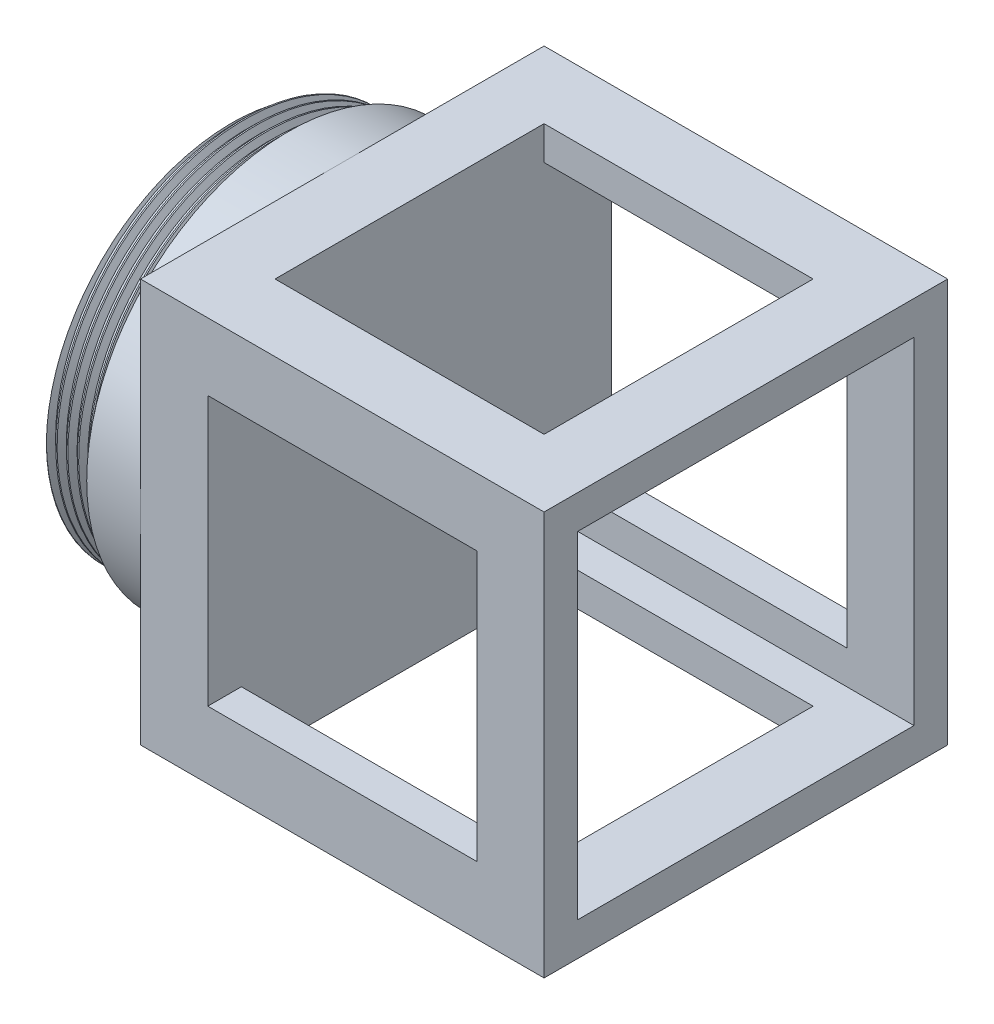
from build123d import *

# Parameters (mm, degrees)
SKETCH1_W           = 75
SKETCH1_H           = 75
SKETCH1_W_2         = 50
SKETCH1_H_2         = 50
BOSS_EXTRUDE1_DEPTH = 37.5
CUT_EXTRUDE1_REACH  = 93.856
SKETCH2_W           = 50
SKETCH2_H           = 50
CUT_EXTRUDE2_REACH  = 93.856
SKETCH3_W           = 62.5
SKETCH3_H           = 62.5
SKETCH4_R           = 37.5
BOSS_EXTRUDE2_DEPTH = 10
SKETCH5_R           = 35
SKETCH5_R_2         = 32.5
BOSS_EXTRUDE3_DEPTH = 10
THREAD4_PITCH       = 2


with BuildPart() as part:
    # Sketch1 → Boss-Extrude1 (new, symmetric)
    with BuildSketch(Plane.XY):
        Rectangle(SKETCH1_W, SKETCH1_H)
        Rectangle(SKETCH1_W_2, SKETCH1_H_2, mode=Mode.SUBTRACT)
    extrude(amount=BOSS_EXTRUDE1_DEPTH, both=True)

    # Cut-Extrude1: up to this face of the body (flat: up to its plane)
    cut_extrude1_end = Plane(part.part.faces().sort_by_distance((0, -37.5, 0))[0])
    # Sketch2 → Cut-Extrude1 (cut, up to the picked face)
    with BuildSketch(Plane(origin=(0, 37.5, 0), x_dir=(1, 0, 0), z_dir=(0, 1, 0)), mode=Mode.PRIVATE) as cut_extrude1_sk1:
        Rectangle(SKETCH2_W, SKETCH2_H)
    cut_extrude1_tool1 = split(extrude(cut_extrude1_sk1.sketch, amount=-CUT_EXTRUDE1_REACH, mode=Mode.PRIVATE), bisect_by=cut_extrude1_end, keep=Keep.BOTH, mode=Mode.PRIVATE)
    add(cut_extrude1_tool1.solids().sort_by(Axis((0, 37.5, 0), (0, -1, 0)))[0], mode=Mode.SUBTRACT)

    # Cut-Extrude2: up to this face of the body (flat: up to its plane)
    cut_extrude2_end = Plane(part.part.faces().sort_by_distance((-25, 0, 0))[0])
    # Sketch3 → Cut-Extrude2 (cut, up to the picked face)
    with BuildSketch(Plane(origin=(37.5, 0, 0), x_dir=(0, 0, -1), z_dir=(1, 0, 0)), mode=Mode.PRIVATE) as cut_extrude2_sk1:
        Rectangle(SKETCH3_W, SKETCH3_H)
    cut_extrude2_tool1 = split(extrude(cut_extrude2_sk1.sketch, amount=-CUT_EXTRUDE2_REACH, mode=Mode.PRIVATE), bisect_by=cut_extrude2_end, keep=Keep.BOTH, mode=Mode.PRIVATE)
    add(cut_extrude2_tool1.solids().sort_by(Axis((37.5, 0, 0), (-1, 0, 0)))[0], mode=Mode.SUBTRACT)

    # Sketch4 → Boss-Extrude2 (add)
    with BuildSketch(Plane.ZY.offset(37.5)):
        Circle(SKETCH4_R)
    extrude(amount=BOSS_EXTRUDE2_DEPTH)

    # Sketch5 → Boss-Extrude3 (add)
    with BuildSketch(Plane.ZY.offset(47.5)):
        Circle(SKETCH5_R)
        Circle(SKETCH5_R_2, mode=Mode.SUBTRACT)
    extrude(amount=BOSS_EXTRUDE3_DEPTH)

    # Thread4: the profile of Thread Profile2 profile screwed along a right-hand helix of 5.5 turns, 10 arcs to a turn; built about Z, then put on its axis
    thread4_z = Axis((0, 0, 0), (0, 0, 1))
    thread4_corners = [(35.0003, 0, -0.000173205), (35.0003, 0, 1.7501732), (33.91746825, 0, 1.124999997), (33.91746825, 0, 0.624999997)]
    with BuildLine(mode=Mode.PRIVATE) as thread4_profile:
        Line(thread4_corners[0], thread4_corners[1])
        Line(thread4_corners[1], thread4_corners[2])
        Line(thread4_corners[2], thread4_corners[3])
        Line(thread4_corners[3], thread4_corners[0])
    thread4_cap = Face(thread4_profile.wire())
    thread4_turn_angles = [0, 18, 36, 54, 72, 90, 108, 126, 144, 162, 180, 198, 216, 234, 252, 270, 288, 306, 324, 342, 360]
    thread4_turn_weights = [1, 0.9510565162951535, 1, 0.9510565162951535, 1, 0.9510565162951535, 1, 0.9510565162951535, 1, 0.9510565162951535, 1, 0.9510565162951535, 1, 0.9510565162951535, 1, 0.9510565162951535, 1, 0.9510565162951535, 1, 0.9510565162951535, 1]
    thread4_turn_rails = [Edge.make_bspline([Vector(p[0], p[1], 0).rotate(thread4_z, thread4_turn_angles[k]) / thread4_turn_weights[k] + Vector(0, 0, p[2] + THREAD4_PITCH * thread4_turn_angles[k] / 360) for k in range(21)], [0, 0, 0, 1, 1, 2, 2, 3, 3, 4, 4, 5, 5, 6, 6, 7, 7, 8, 8, 9, 9, 10, 10, 10], 2, thread4_turn_weights) for p in thread4_corners]
    thread4_turn_sides = [Face.make_surface_from_curves(thread4_turn_rails[p[0]], thread4_turn_rails[p[1]]) for p in [(0, 1), (1, 2), (2, 3), (3, 0)]]
    thread4_last_angles = [1800, 1818, 1836, 1854, 1872, 1890, 1908, 1926, 1944, 1962, 1980]
    thread4_last_weights = [1, 0.9510565162951535, 1, 0.9510565162951535, 1, 0.9510565162951535, 1, 0.9510565162951535, 1, 0.9510565162951518, 1]
    thread4_last_rails = [Edge.make_bspline([Vector(p[0], p[1], 0).rotate(thread4_z, thread4_last_angles[k]) / thread4_last_weights[k] + Vector(0, 0, p[2] + THREAD4_PITCH * thread4_last_angles[k] / 360) for k in range(11)], [0, 0, 0, 1, 1, 2, 2, 3, 3, 4, 4, 5, 5, 5], 2, thread4_last_weights) for p in thread4_corners]
    thread4_last_sides = [Face.make_surface_from_curves(thread4_last_rails[p[0]], thread4_last_rails[p[1]]) for p in [(0, 1), (1, 2), (2, 3), (3, 0)]]
    thread4 = Plane(origin=(-58.5, 0, 0), x_dir=(0, 0, -1), z_dir=(1, 0, 0)) * Solid(Shell([*[p.moved(Location((0, 0, THREAD4_PITCH * i))) for i in range(5) for p in thread4_turn_sides], *thread4_last_sides, thread4_cap, thread4_cap.rotate(thread4_z, 1980).moved(Location((0, 0, THREAD4_PITCH * 1980 / 360)))]))
    add(thread4, mode=Mode.SUBTRACT)


solid = part.part
